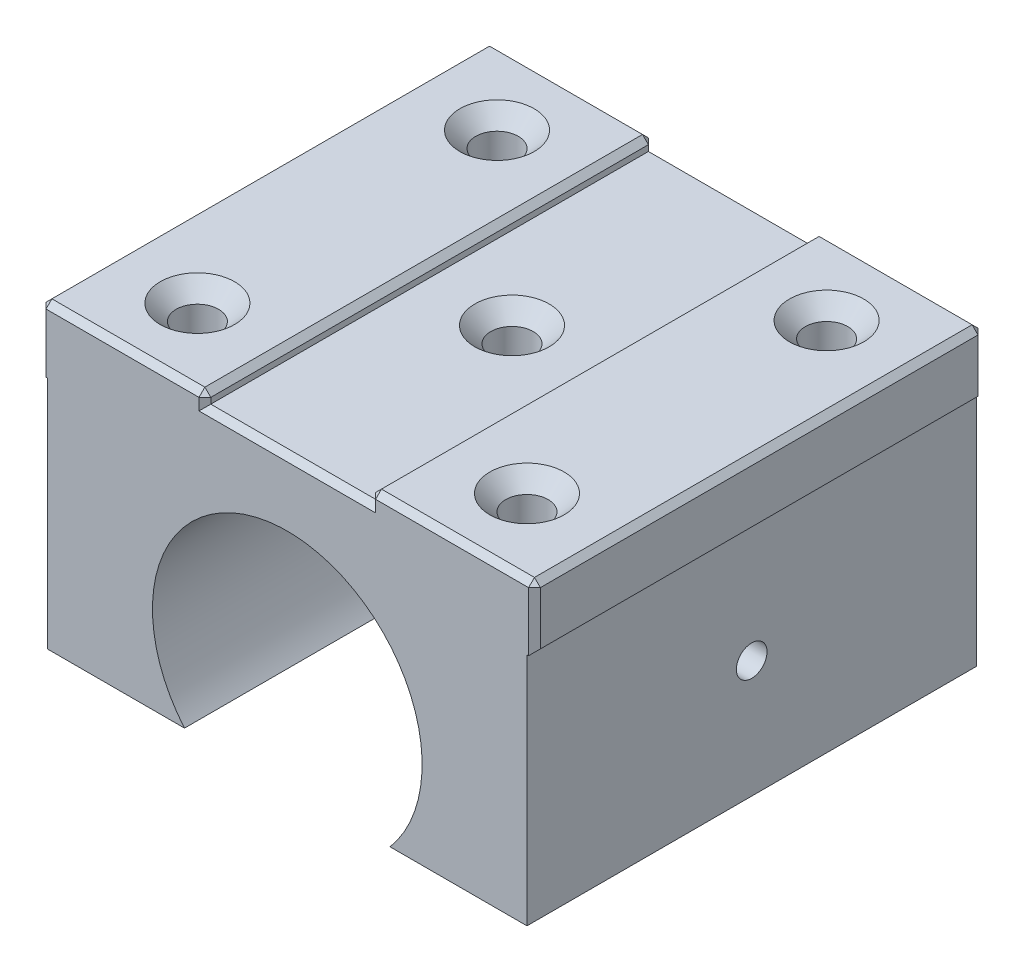
from build123d import *

# Parameters (mm, degrees)
BOSS_EXTRUDE1_DEPTH                                 = 38.1
CSK_FOR_M3_COUNTERSUNK_FLAT_HEAD_SCREW2_D           = 3.6
CSK_FOR_M3_COUNTERSUNK_FLAT_HEAD_SCREW2_DEPTH       = 10
CSK_FOR_M3_COUNTERSUNK_FLAT_HEAD_SCREW2_CSINK_D     = 6.3
CSK_FOR_M3_COUNTERSUNK_FLAT_HEAD_SCREW2_CSINK_ANGLE = 90
CSK_FOR_M3_COUNTERSUNK_FLAT_HEAD_SCREW2_TIP         = 1.081549114
CUT_EXTRUDE1_DEPTH                                  = 48.061034515
CUT_EXTRUDE1_DEPTH_BACK                             = 48.061034515
CSK_FOR_M3_COUNTERSUNK_FLAT_HEAD_SCREW3_D           = 3.6
CSK_FOR_M3_COUNTERSUNK_FLAT_HEAD_SCREW3_DEPTH       = 10
CSK_FOR_M3_COUNTERSUNK_FLAT_HEAD_SCREW3_CSINK_D     = 6.3
CSK_FOR_M3_COUNTERSUNK_FLAT_HEAD_SCREW3_CSINK_ANGLE = 90
CSK_FOR_M3_COUNTERSUNK_FLAT_HEAD_SCREW3_TIP         = 1.081549114
CHAMFER1_SIZE                                       = 0.5
CSK_FOR_M2_COUNTERSUNK_FLAT_HEAD_SCREW2_D           = 2.6
CSK_FOR_M2_COUNTERSUNK_FLAT_HEAD_SCREW2_CSINK_D     = 4.4
CSK_FOR_M2_COUNTERSUNK_FLAT_HEAD_SCREW2_CSINK_ANGLE = 90


with BuildPart() as part:
    # Sketch1 → Boss-Extrude1 (new body)
    with BuildSketch(Plane.XY):
        with BuildLine():
            Line((-20.32, 12.500526233), (-20.32, -7.399473767))
            Line((-20.32, -7.399473767), (-8.711640946, -7.399473767))
            ThreePointArc((-8.711640946, -7.399473767), (0, 11.43), (8.711640946, -7.399473767))
            Line((8.711640946, -7.399473767), (20.32, -7.399473767))
            Line((20.32, -7.399473767), (20.32, 12.500526233))
            Line((20.32, 12.500526233), (20.955, 12.500526233))
            Line((20.955, 12.500526233), (20.955, 18.000526233))
            Line((20.955, 18.000526233), (-20.955, 18.000526233))
            Line((-20.955, 18.000526233), (-20.955, 12.500526233))
            Line((-20.955, 12.500526233), (-20.32, 12.500526233))
        make_face()
    extrude(amount=BOSS_EXTRUDE1_DEPTH)

    # CSK for M3 Countersunk Flat Head Screw2
    with Locations(Plane(origin=(0, 18.000526233, 0), x_dir=(1, 0, 0), z_dir=(0, 1, 0))):
        with Locations((-13.97, -6.35), (-13.97, -31.75), (13.97, -31.75), (13.97, -6.35)):
            CounterSinkHole(CSK_FOR_M3_COUNTERSUNK_FLAT_HEAD_SCREW2_D / 2, CSK_FOR_M3_COUNTERSUNK_FLAT_HEAD_SCREW2_CSINK_D / 2, depth=CSK_FOR_M3_COUNTERSUNK_FLAT_HEAD_SCREW2_DEPTH, counter_sink_angle=CSK_FOR_M3_COUNTERSUNK_FLAT_HEAD_SCREW2_CSINK_ANGLE)
            with Locations((0, 0, -(CSK_FOR_M3_COUNTERSUNK_FLAT_HEAD_SCREW2_DEPTH + CSK_FOR_M3_COUNTERSUNK_FLAT_HEAD_SCREW2_TIP / 2))):  # 118° drill point
                Cone(0, CSK_FOR_M3_COUNTERSUNK_FLAT_HEAD_SCREW2_D / 2, CSK_FOR_M3_COUNTERSUNK_FLAT_HEAD_SCREW2_TIP, mode=Mode.SUBTRACT)

    # Sketch4 → Cut-Extrude1 (cut, two sides: drawn at the far end of the back side and taken through both)
    with BuildSketch(Plane.XY.offset(38.1).offset(-CUT_EXTRUDE1_DEPTH_BACK)):
        Polygon((-6.985, 103.520155469), (-6.985, 18.000526233), (-6.985, 17.000526233), (6.985, 17.000526233), (6.985, 18.000526233), (6.985, 103.520155469), (6.985, 274.559413942), (-6.985, 274.559413942), align=None)
    extrude(amount=CUT_EXTRUDE1_DEPTH + CUT_EXTRUDE1_DEPTH_BACK, mode=Mode.SUBTRACT)

    # CSK for M3 Countersunk Flat Head Screw3
    with Locations(Plane(origin=(0, 17.000526233, 0), x_dir=(1, 0, 0), z_dir=(0, 1, 0))):
        with Locations((0, -19.05)):
            CounterSinkHole(CSK_FOR_M3_COUNTERSUNK_FLAT_HEAD_SCREW3_D / 2, CSK_FOR_M3_COUNTERSUNK_FLAT_HEAD_SCREW3_CSINK_D / 2, depth=CSK_FOR_M3_COUNTERSUNK_FLAT_HEAD_SCREW3_DEPTH, counter_sink_angle=CSK_FOR_M3_COUNTERSUNK_FLAT_HEAD_SCREW3_CSINK_ANGLE)
            with Locations((0, 0, -(CSK_FOR_M3_COUNTERSUNK_FLAT_HEAD_SCREW3_DEPTH + CSK_FOR_M3_COUNTERSUNK_FLAT_HEAD_SCREW3_TIP / 2))):  # 118° drill point
                Cone(0, CSK_FOR_M3_COUNTERSUNK_FLAT_HEAD_SCREW3_D / 2, CSK_FOR_M3_COUNTERSUNK_FLAT_HEAD_SCREW3_TIP, mode=Mode.SUBTRACT)

    # Chamfer1
    chamfer1_edges = [part.edges().sort_by_distance(p)[0] for p in [
        (20.955, 12.500526233, 19.05),
        (13.97, 18.000526233, 0),
        (20.955, 15.250526233, 0),
        (6.985, 17.500526233, 0),
        (6.985, 17.500526233, 38.1),
        (20.955, 18.000526233, 19.05),
        (13.97, 18.000526233, 38.1),
        (6.985, 18.000526233, 19.05),
        (-6.985, 17.500526233, 0),
        (-6.985, 17.500526233, 38.1),
        (-13.97, 18.000526233, 0),
        (-6.985, 18.000526233, 19.05),
        (-13.97, 18.000526233, 38.1),
        (-20.955, 18.000526233, 19.05),
        (-20.955, 12.500526233, 19.05),
        (0, 17.000526233, 0),
        (0, 17.000526233, 38.1),
        (-20.955, 15.250526233, 0),
        (20.955, 15.250526233, 38.1),
        (-20.955, 15.250526233, 38.1),
    ]]
    chamfer(chamfer1_edges, length=CHAMFER1_SIZE)

    # CSK for M2 Countersunk Flat Head Screw2 (through all)
    with Locations(Plane.ZY.offset(20.32)):
        with Locations((19.05, 2.550526233)):
            CounterSinkHole(CSK_FOR_M2_COUNTERSUNK_FLAT_HEAD_SCREW2_D / 2, CSK_FOR_M2_COUNTERSUNK_FLAT_HEAD_SCREW2_CSINK_D / 2, counter_sink_angle=CSK_FOR_M2_COUNTERSUNK_FLAT_HEAD_SCREW2_CSINK_ANGLE)

    # Sketch16 → Revolve4 (revolve)
    with BuildSketch(Plane.XY.offset(33.1)):
        with BuildLine():
            Line((-7.375123728, 7.375123728), (-8.78933729, 8.78933729))
            ThreePointArc((-8.78933729, 8.78933729), (-7.375123728, 8.78933729), (-7.375123728, 7.375123728))
        make_face()
    revolve4 = revolve(axis=Axis((-8.082230509, 8.082230509, 33.1), (0.7071067811865464, -0.7071067811865488, 0)))

    # Mirror1: Revolve4 across plane
    add(revolve4.mirror(Plane(origin=(0, 0, 0), x_dir=(0, 0, 1), z_dir=(1, 0, 0))))

    # LPattern1 copy 1 sketch → LPattern1 copy 1 (revolve)
    with BuildSketch(Plane(origin=(0, 0, 29.977777778), x_dir=(-1, 0, 0), z_dir=(0, 0, 1))):
        with BuildLine():
            Line((-7.375123728, -7.375123728), (-8.78933729, -8.78933729))
            ThreePointArc((-8.78933729, -8.78933729), (-7.375123728, -8.78933729), (-7.375123728, -7.375123728))
        make_face()
    revolve(axis=Axis((8.082230509, 8.082230509, 29.977777778), (0.7071067811865464, 0.7071067811865488, 0)))

    # LPattern1 copy 2 sketch → LPattern1 copy 2 (revolve)
    with BuildSketch(Plane(origin=(0, 0, 26.855555556), x_dir=(-1, 0, 0), z_dir=(0, 0, 1))):
        with BuildLine():
            Line((-7.375123728, -7.375123728), (-8.78933729, -8.78933729))
            ThreePointArc((-8.78933729, -8.78933729), (-7.375123728, -8.78933729), (-7.375123728, -7.375123728))
        make_face()
    revolve(axis=Axis((8.082230509, 8.082230509, 26.855555556), (0.7071067811865464, 0.7071067811865488, 0)))

    # LPattern1 copy 3 sketch → LPattern1 copy 3 (revolve)
    with BuildSketch(Plane(origin=(0, 0, 23.733333333), x_dir=(-1, 0, 0), z_dir=(0, 0, 1))):
        with BuildLine():
            Line((-7.375123728, -7.375123728), (-8.78933729, -8.78933729))
            ThreePointArc((-8.78933729, -8.78933729), (-7.375123728, -8.78933729), (-7.375123728, -7.375123728))
        make_face()
    revolve(axis=Axis((8.082230509, 8.082230509, 23.733333333), (0.7071067811865464, 0.7071067811865488, 0)))

    # LPattern1 copy 4 sketch → LPattern1 copy 4 (revolve)
    with BuildSketch(Plane(origin=(0, 0, 20.611111111), x_dir=(-1, 0, 0), z_dir=(0, 0, 1))):
        with BuildLine():
            Line((-7.375123728, -7.375123728), (-8.78933729, -8.78933729))
            ThreePointArc((-8.78933729, -8.78933729), (-7.375123728, -8.78933729), (-7.375123728, -7.375123728))
        make_face()
    revolve(axis=Axis((8.082230509, 8.082230509, 20.611111111), (0.7071067811865464, 0.7071067811865488, 0)))

    # LPattern1 copy 5 sketch → LPattern1 copy 5 (revolve)
    with BuildSketch(Plane(origin=(0, 0, 17.488888889), x_dir=(-1, 0, 0), z_dir=(0, 0, 1))):
        with BuildLine():
            Line((-7.375123728, -7.375123728), (-8.78933729, -8.78933729))
            ThreePointArc((-8.78933729, -8.78933729), (-7.375123728, -8.78933729), (-7.375123728, -7.375123728))
        make_face()
    revolve(axis=Axis((8.082230509, 8.082230509, 17.488888889), (0.7071067811865464, 0.7071067811865488, 0)))

    # LPattern1 copy 6 sketch → LPattern1 copy 6 (revolve)
    with BuildSketch(Plane(origin=(0, 0, 14.366666667), x_dir=(-1, 0, 0), z_dir=(0, 0, 1))):
        with BuildLine():
            Line((-7.375123728, -7.375123728), (-8.78933729, -8.78933729))
            ThreePointArc((-8.78933729, -8.78933729), (-7.375123728, -8.78933729), (-7.375123728, -7.375123728))
        make_face()
    revolve(axis=Axis((8.082230509, 8.082230509, 14.366666667), (0.7071067811865464, 0.7071067811865488, 0)))

    # LPattern1 copy 7 sketch → LPattern1 copy 7 (revolve)
    with BuildSketch(Plane(origin=(0, 0, 11.244444444), x_dir=(-1, 0, 0), z_dir=(0, 0, 1))):
        with BuildLine():
            Line((-7.375123728, -7.375123728), (-8.78933729, -8.78933729))
            ThreePointArc((-8.78933729, -8.78933729), (-7.375123728, -8.78933729), (-7.375123728, -7.375123728))
        make_face()
    revolve(axis=Axis((8.082230509, 8.082230509, 11.244444444), (0.7071067811865464, 0.7071067811865488, 0)))

    # LPattern1 copy 8 sketch → LPattern1 copy 8 (revolve)
    with BuildSketch(Plane(origin=(0, 0, 8.122222222), x_dir=(-1, 0, 0), z_dir=(0, 0, 1))):
        with BuildLine():
            Line((-7.375123728, -7.375123728), (-8.78933729, -8.78933729))
            ThreePointArc((-8.78933729, -8.78933729), (-7.375123728, -8.78933729), (-7.375123728, -7.375123728))
        make_face()
    revolve(axis=Axis((8.082230509, 8.082230509, 8.122222222), (0.7071067811865464, 0.7071067811865488, 0)))

    # LPattern1 copy 9 sketch → LPattern1 copy 9 (revolve)
    with BuildSketch(Plane(origin=(0, 0, 5), x_dir=(-1, 0, 0), z_dir=(0, 0, 1))):
        with BuildLine():
            Line((-7.375123728, -7.375123728), (-8.78933729, -8.78933729))
            ThreePointArc((-8.78933729, -8.78933729), (-7.375123728, -8.78933729), (-7.375123728, -7.375123728))
        make_face()
    revolve(axis=Axis((8.082230509, 8.082230509, 5), (0.7071067811865464, 0.7071067811865488, 0)))

    # LPattern1 copy 10 sketch → LPattern1 copy 10 (revolve)
    with BuildSketch(Plane.XY.offset(29.977777778)):
        with BuildLine():
            Line((-7.375123728, 7.375123728), (-8.78933729, 8.78933729))
            ThreePointArc((-8.78933729, 8.78933729), (-7.375123728, 8.78933729), (-7.375123728, 7.375123728))
        make_face()
    revolve(axis=Axis((-8.082230509, 8.082230509, 29.977777778), (0.7071067811865464, -0.7071067811865488, 0)))

    # LPattern1 copy 11 sketch → LPattern1 copy 11 (revolve)
    with BuildSketch(Plane.XY.offset(26.855555556)):
        with BuildLine():
            Line((-7.375123728, 7.375123728), (-8.78933729, 8.78933729))
            ThreePointArc((-8.78933729, 8.78933729), (-7.375123728, 8.78933729), (-7.375123728, 7.375123728))
        make_face()
    revolve(axis=Axis((-8.082230509, 8.082230509, 26.855555556), (0.7071067811865464, -0.7071067811865488, 0)))

    # LPattern1 copy 12 sketch → LPattern1 copy 12 (revolve)
    with BuildSketch(Plane.XY.offset(23.733333333)):
        with BuildLine():
            Line((-7.375123728, 7.375123728), (-8.78933729, 8.78933729))
            ThreePointArc((-8.78933729, 8.78933729), (-7.375123728, 8.78933729), (-7.375123728, 7.375123728))
        make_face()
    revolve(axis=Axis((-8.082230509, 8.082230509, 23.733333333), (0.7071067811865464, -0.7071067811865488, 0)))

    # LPattern1 copy 13 sketch → LPattern1 copy 13 (revolve)
    with BuildSketch(Plane.XY.offset(20.611111111)):
        with BuildLine():
            Line((-7.375123728, 7.375123728), (-8.78933729, 8.78933729))
            ThreePointArc((-8.78933729, 8.78933729), (-7.375123728, 8.78933729), (-7.375123728, 7.375123728))
        make_face()
    revolve(axis=Axis((-8.082230509, 8.082230509, 20.611111111), (0.7071067811865464, -0.7071067811865488, 0)))

    # LPattern1 copy 14 sketch → LPattern1 copy 14 (revolve)
    with BuildSketch(Plane.XY.offset(17.488888889)):
        with BuildLine():
            Line((-7.375123728, 7.375123728), (-8.78933729, 8.78933729))
            ThreePointArc((-8.78933729, 8.78933729), (-7.375123728, 8.78933729), (-7.375123728, 7.375123728))
        make_face()
    revolve(axis=Axis((-8.082230509, 8.082230509, 17.488888889), (0.7071067811865464, -0.7071067811865488, 0)))

    # LPattern1 copy 15 sketch → LPattern1 copy 15 (revolve)
    with BuildSketch(Plane.XY.offset(14.366666667)):
        with BuildLine():
            Line((-7.375123728, 7.375123728), (-8.78933729, 8.78933729))
            ThreePointArc((-8.78933729, 8.78933729), (-7.375123728, 8.78933729), (-7.375123728, 7.375123728))
        make_face()
    revolve(axis=Axis((-8.082230509, 8.082230509, 14.366666667), (0.7071067811865464, -0.7071067811865488, 0)))

    # LPattern1 copy 16 sketch → LPattern1 copy 16 (revolve)
    with BuildSketch(Plane.XY.offset(11.244444444)):
        with BuildLine():
            Line((-7.375123728, 7.375123728), (-8.78933729, 8.78933729))
            ThreePointArc((-8.78933729, 8.78933729), (-7.375123728, 8.78933729), (-7.375123728, 7.375123728))
        make_face()
    revolve(axis=Axis((-8.082230509, 8.082230509, 11.244444444), (0.7071067811865464, -0.7071067811865488, 0)))

    # LPattern1 copy 17 sketch → LPattern1 copy 17 (revolve)
    with BuildSketch(Plane.XY.offset(8.122222222)):
        with BuildLine():
            Line((-7.375123728, 7.375123728), (-8.78933729, 8.78933729))
            ThreePointArc((-8.78933729, 8.78933729), (-7.375123728, 8.78933729), (-7.375123728, 7.375123728))
        make_face()
    revolve(axis=Axis((-8.082230509, 8.082230509, 8.122222222), (0.7071067811865464, -0.7071067811865488, 0)))

    # LPattern1 copy 18 sketch → LPattern1 copy 18 (revolve)
    with BuildSketch(Plane.XY.offset(5)):
        with BuildLine():
            Line((-7.375123728, 7.375123728), (-8.78933729, 8.78933729))
            ThreePointArc((-8.78933729, 8.78933729), (-7.375123728, 8.78933729), (-7.375123728, 7.375123728))
        make_face()
    revolve(axis=Axis((-8.082230509, 8.082230509, 5), (0.7071067811865464, -0.7071067811865488, 0)))


solid = part.part
